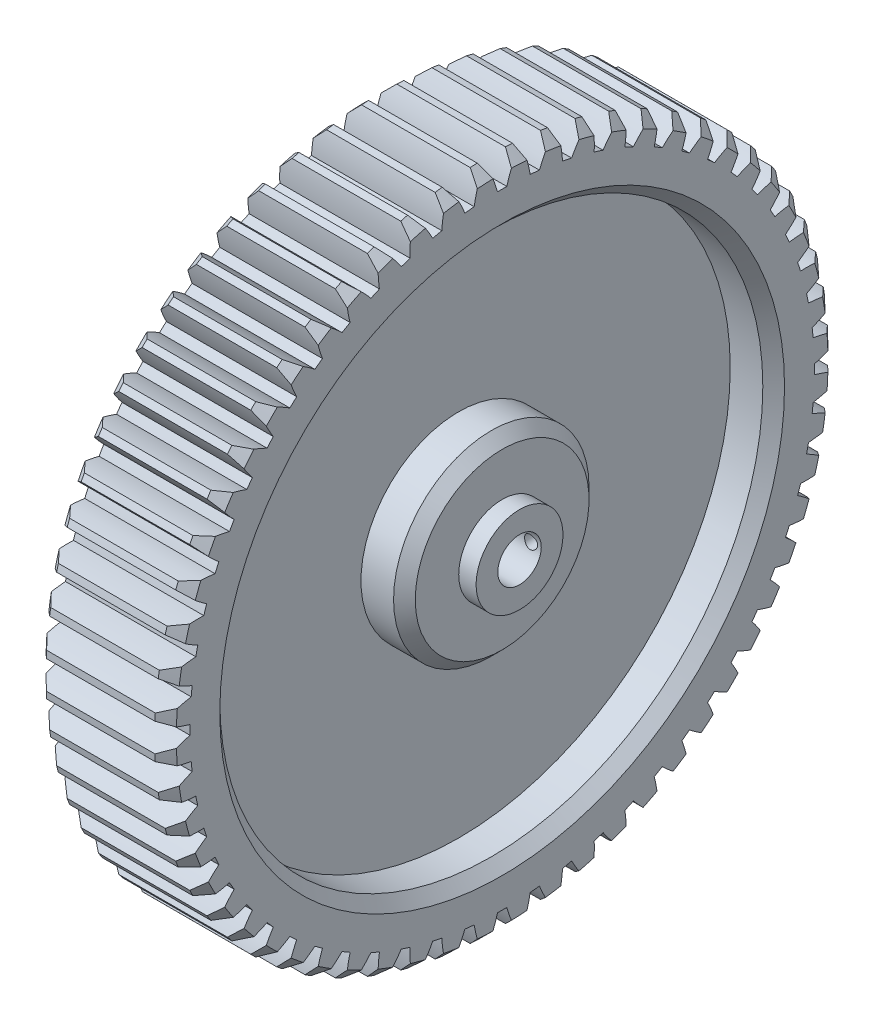
from build123d import *

# Parameters (mm, degrees)
SPUR_GEAR_GB_BORE_OUTLINE_R = 1
SPUR_GEAR_GB_BORE_DEPTH     = 6
SKETCH_2_R                  = 1.5
EXTRUDE_1_DEPTH             = 1
CUT_EXTRUDE_START           = -10
SKETCH_3_R                  = 1.5
CUT_EXTRUDE_1_DEPTH         = 10
EXTRUDE_START               = -6
SKETCH_4_R                  = 1.5
SKETCH_4_R_2                = 1
EXTRUDE_2_DEPTH             = 6
SKETCH_5_R                  = 2
SKETCH_5_R_2                = 1
EXTRUDE_3_DEPTH             = 0.8
CUT_EXTRUDE_2_DEPTH         = 2
CUT_EXTRUDE_2_DEPTH_BACK    = 0.2
SKETCH_6_R                  = 0.3
SKETCH_7_R                  = 12.5
SKETCH_7_R_2                = 4.5
CUT_EXTRUDE_3_DEPTH         = 2
CUT_EXTRUDE_START_2         = -2
SKETCH_8_R                  = 12.5
SKETCH_8_R_2                = 4.5
CUT_EXTRUDE_5_DEPTH         = 2
CHAMFER_5_SIZE              = 0.5
CHAMFER_6_SIZE              = 0.5
CHAMFER_7_SIZE              = 0.5
CHAMFER_8_SIZE              = 0.5
CHAMFER_9_SIZE              = 0.5
CHAMFER_10_SIZE             = 0.5


# Read off the part's stored shape, not the designer's step: <spur gear_gb>-<Bore>
with BuildPart() as part:
    # <spur gear_gb>-<Bore> outline → <spur gear_gb>-<Bore> (new body)
    with BuildSketch(Plane.YZ):
        with BuildLine():
            ThreePointArc((0.972356564, 15.469470667), (0.811207322, 15.478757789), (0.649970103, 15.486366225))
            ThreePointArc((0.649970103, 15.486366225), (0.404629886, 14.940245343), (0.21493681, 14.372392917))
            ThreePointArc((0.21493681, 14.372392917), (0, 14.374), (-0.21493681, 14.372392917))
            ThreePointArc((-0.21493681, 14.372392917), (-0.404629886, 14.940245343), (-0.649970103, 15.486366225))
            ThreePointArc((-0.649970103, 15.486366225), (-0.811207322, 15.478757789), (-0.972356564, 15.469470667))
            ThreePointArc((-0.972356564, 15.469470667), (-1.159267606, 14.900696456), (-1.288564781, 14.31612646))
            ThreePointArc((-1.288564781, 14.31612646), (-1.502492131, 14.295257724), (-1.716083509, 14.271192431))
            ThreePointArc((-1.716083509, 14.271192431), (-1.964094167, 14.816105776), (-2.265175562, 15.333589915))
            ThreePointArc((-2.265175562, 15.333589915), (-2.424734208, 15.309169279), (-2.58402989, 15.283088351))
            ThreePointArc((-2.58402989, 15.283088351), (-2.710463919, 14.69789242), (-2.777948587, 14.103009524))
            ThreePointArc((-2.777948587, 14.103009524), (-2.988522644, 14.059893613), (-3.198428438, 14.013633773))
            ThreePointArc((-3.198428438, 14.013633773), (-3.502039422, 14.529637853), (-3.855563284, 15.012815584))
            ThreePointArc((-3.855563284, 15.012815584), (-4.011695199, 14.971850307), (-4.167392043, 14.92926132))
            ThreePointArc((-4.167392043, 14.92926132), (-4.231963822, 14.3340552), (-4.236896607, 13.735377066))
            ThreePointArc((-4.236896607, 13.735377066), (-4.441810277, 13.670486365), (-4.645730715, 13.602538812))
            ThreePointArc((-4.645730715, 13.602538812), (-5.001615601, 14.083980178), (-5.403708647, 14.527557705))
            ThreePointArc((-5.403708647, 14.527557705), (-5.554703218, 14.470496611), (-5.705095377, 14.411866178))
            ThreePointArc((-5.705095377, 14.411866178), (-5.707097444, 13.813171071), (-5.649424302, 13.217256942))
            ThreePointArc((-5.649424302, 13.217256942), (-5.846432508, 13.131302408), (-6.042133395, 13.042411588))
            ThreePointArc((-6.042133395, 13.042411588), (-6.446393032, 13.484015468), (-6.892649847, 13.883132863))
            ThreePointArc((-6.892649847, 13.883132863), (-7.036852746, 13.810601125), (-7.180292492, 13.736571615))
            ThreePointArc((-7.180292492, 13.736571615), (-7.119702911, 13.140946949), (-7.000055721, 12.554325785))
            ThreePointArc((-7.000055721, 12.554325785), (-7.187, 12.448249154), (-7.372337196, 12.339388974))
            ThreePointArc((-7.372337196, 12.339388974), (-7.820542432, 12.736317063), (-8.306073734, 13.086601512))
            ThreePointArc((-8.306073734, 13.086601512), (-8.441905043, 12.999393803), (-8.57682082, 12.910776298))
            ThreePointArc((-8.57682082, 12.910776298), (-8.454303424, 12.324747862), (-8.273993065, 11.753846807))
            ThreePointArc((-8.273993065, 11.753846807), (-8.448825216, 11.628810277), (-8.621768129, 11.501173433))
            ThreePointArc((-8.621768129, 11.501173433), (-9.109008332, 11.849076903), (-9.628494538, 12.146690616))
            ThreePointArc((-9.628494538, 12.146690616), (-9.754466061, 12.045762403), (-9.879379704, 11.943527815))
            ThreePointArc((-9.879379704, 11.943527815), (-9.69627682, 11.373516259), (-9.457278809, 10.824590224))
            ThreePointArc((-9.457278809, 10.824590224), (-9.618083336, 10.681963721), (-9.776737166, 10.536948628))
            ThreePointArc((-9.776737166, 10.536948628), (-10.297674032, 10.832015777), (-10.845423542, 11.073698037))
            ThreePointArc((-10.845423542, 11.073698037), (-10.960155108, 10.960155108), (-11.073698037, 10.845423542))
            ThreePointArc((-11.073698037, 10.845423542), (-10.832015777, 10.297674032), (-10.536948628, 9.776737166))
            ThreePointArc((-10.536948628, 9.776737166), (-10.681963721, 9.618083336), (-10.824590224, 9.457278809))
            ThreePointArc((-10.824590224, 9.457278809), (-11.373516259, 9.69627682), (-11.943527815, 9.879379704))
            ThreePointArc((-11.943527815, 9.879379704), (-12.045762403, 9.754466061), (-12.146690616, 9.628494538))
            ThreePointArc((-12.146690616, 9.628494538), (-11.849076903, 9.109008332), (-11.501173433, 8.621768129))
            ThreePointArc((-11.501173433, 8.621768129), (-11.628810277, 8.448825216), (-11.753846807, 8.273993065))
            ThreePointArc((-11.753846807, 8.273993065), (-12.324747862, 8.454303424), (-12.910776298, 8.57682082))
            ThreePointArc((-12.910776298, 8.57682082), (-12.999393803, 8.441905043), (-13.086601512, 8.306073734))
            ThreePointArc((-13.086601512, 8.306073734), (-12.736317063, 7.820542432), (-12.339388974, 7.372337196))
            ThreePointArc((-12.339388974, 7.372337196), (-12.448249154, 7.187), (-12.554325785, 7.000055721))
            ThreePointArc((-12.554325785, 7.000055721), (-13.140946949, 7.119702911), (-13.736571615, 7.180292492))
            ThreePointArc((-13.736571615, 7.180292492), (-13.810601125, 7.036852746), (-13.883132863, 6.892649847))
            ThreePointArc((-13.883132863, 6.892649847), (-13.484015468, 6.446393032), (-13.042411588, 6.042133395))
            ThreePointArc((-13.042411588, 6.042133395), (-13.131302408, 5.846432508), (-13.217256942, 5.649424302))
            ThreePointArc((-13.217256942, 5.649424302), (-13.813171071, 5.707097444), (-14.411866178, 5.705095377))
            ThreePointArc((-14.411866178, 5.705095377), (-14.470496611, 5.554703218), (-14.527557705, 5.403708647))
            ThreePointArc((-14.527557705, 5.403708647), (-14.083980178, 5.001615601), (-13.602538812, 4.645730715))
            ThreePointArc((-13.602538812, 4.645730715), (-13.670486365, 4.441810277), (-13.735377066, 4.236896607))
            ThreePointArc((-13.735377066, 4.236896607), (-14.3340552, 4.231963822), (-14.92926132, 4.167392043))
            ThreePointArc((-14.92926132, 4.167392043), (-14.971850307, 4.011695199), (-15.012815584, 3.855563284))
            ThreePointArc((-15.012815584, 3.855563284), (-14.529637853, 3.502039422), (-14.013633773, 3.198428438))
            ThreePointArc((-14.013633773, 3.198428438), (-14.059893613, 2.988522644), (-14.103009524, 2.777948587))
            ThreePointArc((-14.103009524, 2.777948587), (-14.69789242, 2.710463919), (-15.283088351, 2.58402989))
            ThreePointArc((-15.283088351, 2.58402989), (-15.309169279, 2.424734208), (-15.333589915, 2.265175562))
            ThreePointArc((-15.333589915, 2.265175562), (-14.816105776, 1.964094167), (-14.271192431, 1.716083509))
            ThreePointArc((-14.271192431, 1.716083509), (-14.295257724, 1.502492131), (-14.31612646, 1.288564781))
            ThreePointArc((-14.31612646, 1.288564781), (-14.900696456, 1.159267606), (-15.469470667, 0.972356564))
            ThreePointArc((-15.469470667, 0.972356564), (-15.478757789, 0.811207322), (-15.486366225, 0.649970103))
            ThreePointArc((-15.486366225, 0.649970103), (-14.940245343, 0.404629886), (-14.372392917, 0.21493681))
            ThreePointArc((-14.372392917, 0.21493681), (-14.374, 0), (-14.372392917, -0.21493681))
            ThreePointArc((-14.372392917, -0.21493681), (-14.940245343, -0.404629886), (-15.486366225, -0.649970103))
            ThreePointArc((-15.486366225, -0.649970103), (-15.478757789, -0.811207322), (-15.469470667, -0.972356564))
            ThreePointArc((-15.469470667, -0.972356564), (-14.900696456, -1.159267606), (-14.31612646, -1.288564781))
            ThreePointArc((-14.31612646, -1.288564781), (-14.295257724, -1.502492131), (-14.271192431, -1.716083509))
            ThreePointArc((-14.271192431, -1.716083509), (-14.816105776, -1.964094167), (-15.333589915, -2.265175562))
            ThreePointArc((-15.333589915, -2.265175562), (-15.309169279, -2.424734208), (-15.283088351, -2.58402989))
            ThreePointArc((-15.283088351, -2.58402989), (-14.69789242, -2.710463919), (-14.103009524, -2.777948587))
            ThreePointArc((-14.103009524, -2.777948587), (-14.059893613, -2.988522644), (-14.013633773, -3.198428438))
            ThreePointArc((-14.013633773, -3.198428438), (-14.529637853, -3.502039422), (-15.012815584, -3.855563284))
            ThreePointArc((-15.012815584, -3.855563284), (-14.971850307, -4.011695199), (-14.92926132, -4.167392043))
            ThreePointArc((-14.92926132, -4.167392043), (-14.3340552, -4.231963822), (-13.735377066, -4.236896607))
            ThreePointArc((-13.735377066, -4.236896607), (-13.670486365, -4.441810277), (-13.602538812, -4.645730715))
            ThreePointArc((-13.602538812, -4.645730715), (-14.083980178, -5.001615601), (-14.527557705, -5.403708647))
            ThreePointArc((-14.527557705, -5.403708647), (-14.470496611, -5.554703218), (-14.411866178, -5.705095377))
            ThreePointArc((-14.411866178, -5.705095377), (-13.813171071, -5.707097444), (-13.217256942, -5.649424302))
            ThreePointArc((-13.217256942, -5.649424302), (-13.131302408, -5.846432508), (-13.042411588, -6.042133395))
            ThreePointArc((-13.042411588, -6.042133395), (-13.484015468, -6.446393032), (-13.883132863, -6.892649847))
            ThreePointArc((-13.883132863, -6.892649847), (-13.810601125, -7.036852746), (-13.736571615, -7.180292492))
            ThreePointArc((-13.736571615, -7.180292492), (-13.140946949, -7.119702911), (-12.554325785, -7.000055721))
            ThreePointArc((-12.554325785, -7.000055721), (-12.448249154, -7.187), (-12.339388974, -7.372337196))
            ThreePointArc((-12.339388974, -7.372337196), (-12.736317063, -7.820542432), (-13.086601512, -8.306073734))
            ThreePointArc((-13.086601512, -8.306073734), (-12.999393803, -8.441905043), (-12.910776298, -8.57682082))
            ThreePointArc((-12.910776298, -8.57682082), (-12.324747862, -8.454303424), (-11.753846807, -8.273993065))
            ThreePointArc((-11.753846807, -8.273993065), (-11.628810277, -8.448825216), (-11.501173433, -8.621768129))
            ThreePointArc((-11.501173433, -8.621768129), (-11.849076903, -9.109008332), (-12.146690616, -9.628494538))
            ThreePointArc((-12.146690616, -9.628494538), (-12.045762403, -9.754466061), (-11.943527815, -9.879379704))
            ThreePointArc((-11.943527815, -9.879379704), (-11.373516259, -9.69627682), (-10.824590224, -9.457278809))
            ThreePointArc((-10.824590224, -9.457278809), (-10.681963721, -9.618083336), (-10.536948628, -9.776737166))
            ThreePointArc((-10.536948628, -9.776737166), (-10.832015777, -10.297674032), (-11.073698037, -10.845423542))
            ThreePointArc((-11.073698037, -10.845423542), (-10.960155108, -10.960155108), (-10.845423542, -11.073698037))
            ThreePointArc((-10.845423542, -11.073698037), (-10.297674032, -10.832015777), (-9.776737166, -10.536948628))
            ThreePointArc((-9.776737166, -10.536948628), (-9.618083336, -10.681963721), (-9.457278809, -10.824590224))
            ThreePointArc((-9.457278809, -10.824590224), (-9.69627682, -11.373516259), (-9.879379704, -11.943527815))
            ThreePointArc((-9.879379704, -11.943527815), (-9.754466061, -12.045762403), (-9.628494538, -12.146690616))
            ThreePointArc((-9.628494538, -12.146690616), (-9.109008332, -11.849076903), (-8.621768129, -11.501173433))
            ThreePointArc((-8.621768129, -11.501173433), (-8.448825216, -11.628810277), (-8.273993065, -11.753846807))
            ThreePointArc((-8.273993065, -11.753846807), (-8.454303424, -12.324747862), (-8.57682082, -12.910776298))
            ThreePointArc((-8.57682082, -12.910776298), (-8.441905043, -12.999393803), (-8.306073734, -13.086601512))
            ThreePointArc((-8.306073734, -13.086601512), (-7.820542432, -12.736317063), (-7.372337196, -12.339388974))
            ThreePointArc((-7.372337196, -12.339388974), (-7.187, -12.448249154), (-7.000055721, -12.554325785))
            ThreePointArc((-7.000055721, -12.554325785), (-7.119702911, -13.140946949), (-7.180292492, -13.736571615))
            ThreePointArc((-7.180292492, -13.736571615), (-7.036852746, -13.810601125), (-6.892649847, -13.883132863))
            ThreePointArc((-6.892649847, -13.883132863), (-6.446393032, -13.484015468), (-6.042133395, -13.042411588))
            ThreePointArc((-6.042133395, -13.042411588), (-5.846432508, -13.131302408), (-5.649424302, -13.217256942))
            ThreePointArc((-5.649424302, -13.217256942), (-5.707097444, -13.813171071), (-5.705095377, -14.411866178))
            ThreePointArc((-5.705095377, -14.411866178), (-5.554703218, -14.470496611), (-5.403708647, -14.527557705))
            ThreePointArc((-5.403708647, -14.527557705), (-5.001615601, -14.083980178), (-4.645730715, -13.602538812))
            ThreePointArc((-4.645730715, -13.602538812), (-4.441810277, -13.670486365), (-4.236896607, -13.735377066))
            ThreePointArc((-4.236896607, -13.735377066), (-4.231963822, -14.3340552), (-4.167392043, -14.92926132))
            ThreePointArc((-4.167392043, -14.92926132), (-4.011695199, -14.971850307), (-3.855563284, -15.012815584))
            ThreePointArc((-3.855563284, -15.012815584), (-3.502039422, -14.529637853), (-3.198428438, -14.013633773))
            ThreePointArc((-3.198428438, -14.013633773), (-2.988522644, -14.059893613), (-2.777948587, -14.103009524))
            ThreePointArc((-2.777948587, -14.103009524), (-2.710463919, -14.69789242), (-2.58402989, -15.283088351))
            ThreePointArc((-2.58402989, -15.283088351), (-2.424734208, -15.309169279), (-2.265175562, -15.333589915))
            ThreePointArc((-2.265175562, -15.333589915), (-1.964094167, -14.816105776), (-1.716083509, -14.271192431))
            ThreePointArc((-1.716083509, -14.271192431), (-1.502492131, -14.295257724), (-1.288564781, -14.31612646))
            ThreePointArc((-1.288564781, -14.31612646), (-1.159267606, -14.900696456), (-0.972356564, -15.469470667))
            ThreePointArc((-0.972356564, -15.469470667), (-0.811207322, -15.478757789), (-0.649970103, -15.486366225))
            ThreePointArc((-0.649970103, -15.486366225), (-0.404629886, -14.940245343), (-0.21493681, -14.372392917))
            ThreePointArc((-0.21493681, -14.372392917), (0, -14.374), (0.21493681, -14.372392917))
            ThreePointArc((0.21493681, -14.372392917), (0.404629886, -14.940245343), (0.649970103, -15.486366225))
            ThreePointArc((0.649970103, -15.486366225), (0.811207322, -15.478757789), (0.972356564, -15.469470667))
            ThreePointArc((0.972356564, -15.469470667), (1.159267606, -14.900696456), (1.288564781, -14.31612646))
            ThreePointArc((1.288564781, -14.31612646), (1.502492131, -14.295257724), (1.716083509, -14.271192431))
            ThreePointArc((1.716083509, -14.271192431), (1.964094167, -14.816105776), (2.265175562, -15.333589915))
            ThreePointArc((2.265175562, -15.333589915), (2.424734208, -15.309169279), (2.58402989, -15.283088351))
            ThreePointArc((2.58402989, -15.283088351), (2.710463919, -14.69789242), (2.777948587, -14.103009524))
            ThreePointArc((2.777948587, -14.103009524), (2.988522644, -14.059893613), (3.198428438, -14.013633773))
            ThreePointArc((3.198428438, -14.013633773), (3.502039422, -14.529637853), (3.855563284, -15.012815584))
            ThreePointArc((3.855563284, -15.012815584), (4.011695199, -14.971850307), (4.167392043, -14.92926132))
            ThreePointArc((4.167392043, -14.92926132), (4.231963822, -14.3340552), (4.236896607, -13.735377066))
            ThreePointArc((4.236896607, -13.735377066), (4.441810277, -13.670486365), (4.645730715, -13.602538812))
            ThreePointArc((4.645730715, -13.602538812), (5.001615601, -14.083980178), (5.403708647, -14.527557705))
            ThreePointArc((5.403708647, -14.527557705), (5.554703218, -14.470496611), (5.705095377, -14.411866178))
            ThreePointArc((5.705095377, -14.411866178), (5.707097444, -13.813171071), (5.649424302, -13.217256942))
            ThreePointArc((5.649424302, -13.217256942), (5.846432508, -13.131302408), (6.042133395, -13.042411588))
            ThreePointArc((6.042133395, -13.042411588), (6.446393032, -13.484015468), (6.892649847, -13.883132863))
            ThreePointArc((6.892649847, -13.883132863), (7.036852746, -13.810601125), (7.180292492, -13.736571615))
            ThreePointArc((7.180292492, -13.736571615), (7.119702911, -13.140946949), (7.000055721, -12.554325785))
            ThreePointArc((7.000055721, -12.554325785), (7.187, -12.448249154), (7.372337196, -12.339388974))
            ThreePointArc((7.372337196, -12.339388974), (7.820542432, -12.736317063), (8.306073734, -13.086601512))
            ThreePointArc((8.306073734, -13.086601512), (8.441905043, -12.999393803), (8.57682082, -12.910776298))
            ThreePointArc((8.57682082, -12.910776298), (8.454303424, -12.324747862), (8.273993065, -11.753846807))
            ThreePointArc((8.273993065, -11.753846807), (8.448825216, -11.628810277), (8.621768129, -11.501173433))
            ThreePointArc((8.621768129, -11.501173433), (9.109008332, -11.849076903), (9.628494538, -12.146690616))
            ThreePointArc((9.628494538, -12.146690616), (9.754466061, -12.045762403), (9.879379704, -11.943527815))
            ThreePointArc((9.879379704, -11.943527815), (9.69627682, -11.373516259), (9.457278809, -10.824590224))
            ThreePointArc((9.457278809, -10.824590224), (9.618083336, -10.681963721), (9.776737166, -10.536948628))
            ThreePointArc((9.776737166, -10.536948628), (10.297674032, -10.832015777), (10.845423542, -11.073698037))
            ThreePointArc((10.845423542, -11.073698037), (10.960155108, -10.960155108), (11.073698037, -10.845423542))
            ThreePointArc((11.073698037, -10.845423542), (10.832015777, -10.297674032), (10.536948628, -9.776737166))
            ThreePointArc((10.536948628, -9.776737166), (10.681963721, -9.618083336), (10.824590224, -9.457278809))
            ThreePointArc((10.824590224, -9.457278809), (11.373516259, -9.69627682), (11.943527815, -9.879379704))
            ThreePointArc((11.943527815, -9.879379704), (12.045762403, -9.754466061), (12.146690616, -9.628494538))
            ThreePointArc((12.146690616, -9.628494538), (11.849076903, -9.109008332), (11.501173433, -8.621768129))
            ThreePointArc((11.501173433, -8.621768129), (11.628810277, -8.448825216), (11.753846807, -8.273993065))
            ThreePointArc((11.753846807, -8.273993065), (12.324747862, -8.454303424), (12.910776298, -8.57682082))
            ThreePointArc((12.910776298, -8.57682082), (12.999393803, -8.441905043), (13.086601512, -8.306073734))
            ThreePointArc((13.086601512, -8.306073734), (12.736317063, -7.820542432), (12.339388974, -7.372337196))
            ThreePointArc((12.339388974, -7.372337196), (12.448249154, -7.187), (12.554325785, -7.000055721))
            ThreePointArc((12.554325785, -7.000055721), (13.140946949, -7.119702911), (13.736571615, -7.180292492))
            ThreePointArc((13.736571615, -7.180292492), (13.810601125, -7.036852746), (13.883132863, -6.892649847))
            ThreePointArc((13.883132863, -6.892649847), (13.484015468, -6.446393032), (13.042411588, -6.042133395))
            ThreePointArc((13.042411588, -6.042133395), (13.131302408, -5.846432508), (13.217256942, -5.649424302))
            ThreePointArc((13.217256942, -5.649424302), (13.813171071, -5.707097444), (14.411866178, -5.705095377))
            ThreePointArc((14.411866178, -5.705095377), (14.470496611, -5.554703218), (14.527557705, -5.403708647))
            ThreePointArc((14.527557705, -5.403708647), (14.083980178, -5.001615601), (13.602538812, -4.645730715))
            ThreePointArc((13.602538812, -4.645730715), (13.670486365, -4.441810277), (13.735377066, -4.236896607))
            ThreePointArc((13.735377066, -4.236896607), (14.3340552, -4.231963822), (14.92926132, -4.167392043))
            ThreePointArc((14.92926132, -4.167392043), (14.971850307, -4.011695199), (15.012815584, -3.855563284))
            ThreePointArc((15.012815584, -3.855563284), (14.529637853, -3.502039422), (14.013633773, -3.198428438))
            ThreePointArc((14.013633773, -3.198428438), (14.059893613, -2.988522644), (14.103009524, -2.777948587))
            ThreePointArc((14.103009524, -2.777948587), (14.69789242, -2.710463919), (15.283088351, -2.58402989))
            ThreePointArc((15.283088351, -2.58402989), (15.309169279, -2.424734208), (15.333589915, -2.265175562))
            ThreePointArc((15.333589915, -2.265175562), (14.816105776, -1.964094167), (14.271192431, -1.716083509))
            ThreePointArc((14.271192431, -1.716083509), (14.295257724, -1.502492131), (14.31612646, -1.288564781))
            ThreePointArc((14.31612646, -1.288564781), (14.900696456, -1.159267606), (15.469470667, -0.972356564))
            ThreePointArc((15.469470667, -0.972356564), (15.478757789, -0.811207322), (15.486366225, -0.649970103))
            ThreePointArc((15.486366225, -0.649970103), (14.940245343, -0.404629886), (14.372392917, -0.21493681))
            ThreePointArc((14.372392917, -0.21493681), (14.374, 0), (14.372392917, 0.21493681))
            ThreePointArc((14.372392917, 0.21493681), (14.940245343, 0.404629886), (15.486366225, 0.649970103))
            ThreePointArc((15.486366225, 0.649970103), (15.478757789, 0.811207322), (15.469470667, 0.972356564))
            ThreePointArc((15.469470667, 0.972356564), (14.900696456, 1.159267606), (14.31612646, 1.288564781))
            ThreePointArc((14.31612646, 1.288564781), (14.295257724, 1.502492131), (14.271192431, 1.716083509))
            ThreePointArc((14.271192431, 1.716083509), (14.816105776, 1.964094167), (15.333589915, 2.265175562))
            ThreePointArc((15.333589915, 2.265175562), (15.309169279, 2.424734208), (15.283088351, 2.58402989))
            ThreePointArc((15.283088351, 2.58402989), (14.69789242, 2.710463919), (14.103009524, 2.777948587))
            ThreePointArc((14.103009524, 2.777948587), (14.059893613, 2.988522644), (14.013633773, 3.198428438))
            ThreePointArc((14.013633773, 3.198428438), (14.529637853, 3.502039422), (15.012815584, 3.855563284))
            ThreePointArc((15.012815584, 3.855563284), (14.971850307, 4.011695199), (14.92926132, 4.167392043))
            ThreePointArc((14.92926132, 4.167392043), (14.3340552, 4.231963822), (13.735377066, 4.236896607))
            ThreePointArc((13.735377066, 4.236896607), (13.670486365, 4.441810277), (13.602538812, 4.645730715))
            ThreePointArc((13.602538812, 4.645730715), (14.083980178, 5.001615601), (14.527557705, 5.403708647))
            ThreePointArc((14.527557705, 5.403708647), (14.470496611, 5.554703218), (14.411866178, 5.705095377))
            ThreePointArc((14.411866178, 5.705095377), (13.813171071, 5.707097444), (13.217256942, 5.649424302))
            ThreePointArc((13.217256942, 5.649424302), (13.131302408, 5.846432508), (13.042411588, 6.042133395))
            ThreePointArc((13.042411588, 6.042133395), (13.484015468, 6.446393032), (13.883132863, 6.892649847))
            ThreePointArc((13.883132863, 6.892649847), (13.810601125, 7.036852746), (13.736571615, 7.180292492))
            ThreePointArc((13.736571615, 7.180292492), (13.140946949, 7.119702911), (12.554325785, 7.000055721))
            ThreePointArc((12.554325785, 7.000055721), (12.448249154, 7.187), (12.339388974, 7.372337196))
            ThreePointArc((12.339388974, 7.372337196), (12.736317063, 7.820542432), (13.086601512, 8.306073734))
            ThreePointArc((13.086601512, 8.306073734), (12.999393803, 8.441905043), (12.910776298, 8.57682082))
            ThreePointArc((12.910776298, 8.57682082), (12.324747862, 8.454303424), (11.753846807, 8.273993065))
            ThreePointArc((11.753846807, 8.273993065), (11.628810277, 8.448825216), (11.501173433, 8.621768129))
            ThreePointArc((11.501173433, 8.621768129), (11.849076903, 9.109008332), (12.146690616, 9.628494538))
            ThreePointArc((12.146690616, 9.628494538), (12.045762403, 9.754466061), (11.943527815, 9.879379704))
            ThreePointArc((11.943527815, 9.879379704), (11.373516259, 9.69627682), (10.824590224, 9.457278809))
            ThreePointArc((10.824590224, 9.457278809), (10.681963721, 9.618083336), (10.536948628, 9.776737166))
            ThreePointArc((10.536948628, 9.776737166), (10.832015777, 10.297674032), (11.073698037, 10.845423542))
            ThreePointArc((11.073698037, 10.845423542), (10.960155108, 10.960155108), (10.845423542, 11.073698037))
            ThreePointArc((10.845423542, 11.073698037), (10.297674032, 10.832015777), (9.776737166, 10.536948628))
            ThreePointArc((9.776737166, 10.536948628), (9.618083336, 10.681963721), (9.457278809, 10.824590224))
            ThreePointArc((9.457278809, 10.824590224), (9.69627682, 11.373516259), (9.879379704, 11.943527815))
            ThreePointArc((9.879379704, 11.943527815), (9.754466061, 12.045762403), (9.628494538, 12.146690616))
            ThreePointArc((9.628494538, 12.146690616), (9.109008332, 11.849076903), (8.621768129, 11.501173433))
            ThreePointArc((8.621768129, 11.501173433), (8.448825216, 11.628810277), (8.273993065, 11.753846807))
            ThreePointArc((8.273993065, 11.753846807), (8.454303424, 12.324747862), (8.57682082, 12.910776298))
            ThreePointArc((8.57682082, 12.910776298), (8.441905043, 12.999393803), (8.306073734, 13.086601512))
            ThreePointArc((8.306073734, 13.086601512), (7.820542432, 12.736317063), (7.372337196, 12.339388974))
            ThreePointArc((7.372337196, 12.339388974), (7.187, 12.448249154), (7.000055721, 12.554325785))
            ThreePointArc((7.000055721, 12.554325785), (7.119702911, 13.140946949), (7.180292492, 13.736571615))
            ThreePointArc((7.180292492, 13.736571615), (7.036852746, 13.810601125), (6.892649847, 13.883132863))
            ThreePointArc((6.892649847, 13.883132863), (6.446393032, 13.484015468), (6.042133395, 13.042411588))
            ThreePointArc((6.042133395, 13.042411588), (5.846432508, 13.131302408), (5.649424302, 13.217256942))
            ThreePointArc((5.649424302, 13.217256942), (5.707097444, 13.813171071), (5.705095377, 14.411866178))
            ThreePointArc((5.705095377, 14.411866178), (5.554703218, 14.470496611), (5.403708647, 14.527557705))
            ThreePointArc((5.403708647, 14.527557705), (5.001615601, 14.083980178), (4.645730715, 13.602538812))
            ThreePointArc((4.645730715, 13.602538812), (4.441810277, 13.670486365), (4.236896607, 13.735377066))
            ThreePointArc((4.236896607, 13.735377066), (4.231963822, 14.3340552), (4.167392043, 14.92926132))
            ThreePointArc((4.167392043, 14.92926132), (4.011695199, 14.971850307), (3.855563284, 15.012815584))
            ThreePointArc((3.855563284, 15.012815584), (3.502039422, 14.529637853), (3.198428438, 14.013633773))
            ThreePointArc((3.198428438, 14.013633773), (2.988522644, 14.059893613), (2.777948587, 14.103009524))
            ThreePointArc((2.777948587, 14.103009524), (2.710463919, 14.69789242), (2.58402989, 15.283088351))
            ThreePointArc((2.58402989, 15.283088351), (2.424734208, 15.309169279), (2.265175562, 15.333589915))
            ThreePointArc((2.265175562, 15.333589915), (1.964094167, 14.816105776), (1.716083509, 14.271192431))
            ThreePointArc((1.716083509, 14.271192431), (1.502492131, 14.295257724), (1.288564781, 14.31612646))
            ThreePointArc((1.288564781, 14.31612646), (1.159267606, 14.900696456), (0.972356564, 15.469470667))
        make_face()
        Circle(SPUR_GEAR_GB_BORE_OUTLINE_R, mode=Mode.SUBTRACT)
    extrude(amount=SPUR_GEAR_GB_BORE_DEPTH)

    # 草图2 → 凸台-拉伸1 (add)
    with BuildSketch(Plane(origin=(6, 0, 0), x_dir=(0, 0, -1), z_dir=(1, 0, 0))):
        with Locations(Location((0, 0, 0), (0, 0, 180))):
            Circle(SKETCH_2_R)
    extrude(amount=EXTRUDE_1_DEPTH)

    # 草图3 → 切除-拉伸1 (cut)
    with BuildSketch(Plane(origin=(7, 0, 0), x_dir=(0, 0, -1), z_dir=(1, 0, 0)).offset(CUT_EXTRUDE_START)):
        Circle(SKETCH_3_R)
    extrude(amount=CUT_EXTRUDE_1_DEPTH, mode=Mode.SUBTRACT)

    # 草图4 → 凸台-拉伸2 (add)
    with BuildSketch(Plane(origin=(6, 0, 0), x_dir=(0, 0, -1), z_dir=(1, 0, 0)).offset(EXTRUDE_START)):
        Circle(SKETCH_4_R)
        Circle(SKETCH_4_R_2, mode=Mode.SUBTRACT)
    extrude(amount=EXTRUDE_2_DEPTH)

    # 草图5 → 凸台-拉伸3 (add)
    with BuildSketch(Plane(origin=(6, 0, 0), x_dir=(0, 0, -1), z_dir=(1, 0, 0))):
        with Locations(Location((0, 0, 0), (0, 0, 180))):
            Circle(SKETCH_5_R)
        Circle(SKETCH_5_R_2, mode=Mode.SUBTRACT)
    extrude(amount=EXTRUDE_3_DEPTH)

    # 草图6 → 切除-拉伸2 (cut, two sides: drawn at the far end of the back side and taken through both)
    with BuildSketch(Plane(origin=(56.1762727, -65.617825142, -4.474593868), x_dir=(-1, 0, 0), z_dir=(-2.4747772696104695e-14, -0.03776532736820143, 0.9992866355799884)).offset(-CUT_EXTRUDE_2_DEPTH_BACK)):
        with Locations(Location((49.842566165, -65.698034164, 0), (0, 0, 270))):
            Circle(SKETCH_6_R)
    extrude(amount=CUT_EXTRUDE_2_DEPTH + CUT_EXTRUDE_2_DEPTH_BACK, mode=Mode.SUBTRACT)

    # 草图7 → 切除-拉伸3 (cut)
    with BuildSketch(Plane(origin=(6, 0, 0), x_dir=(0, 0, -1), z_dir=(1, 0, 0))):
        Circle(SKETCH_7_R)
        Circle(SKETCH_7_R_2, mode=Mode.SUBTRACT)
    extrude(amount=-CUT_EXTRUDE_3_DEPTH, mode=Mode.SUBTRACT)

    # 草图8 → 切除-拉伸5 (cut)
    with BuildSketch(Plane.ZY.offset(CUT_EXTRUDE_START_2)):
        with Locations(Location((0, 0, 0), (0, 0, 180))):
            Circle(SKETCH_8_R)
        with Locations(Location((0, 0, 0), (0, 0, 180))):
            Circle(SKETCH_8_R_2, mode=Mode.SUBTRACT)
    extrude(amount=CUT_EXTRUDE_5_DEPTH, mode=Mode.SUBTRACT)

    # 倒角5
    chamfer_5_edges = [part.edges().sort_by_distance(p)[0] for p in [
        (6, 0, 12.5),
    ]]
    chamfer(chamfer_5_edges, length=CHAMFER_5_SIZE)

    # 倒角6
    chamfer_6_edges = [part.edges().sort_by_distance(p)[0] for p in [
        (6, 0, 4.5),
    ]]
    chamfer(chamfer_6_edges, length=CHAMFER_6_SIZE)

    # 倒角7
    chamfer_7_edges = [part.edges().sort_by_distance(p)[0] for p in [
        (0, 0, 4.5),
    ]]
    chamfer(chamfer_7_edges, length=CHAMFER_7_SIZE)

    # 倒角8
    chamfer_8_edges = [part.edges().sort_by_distance(p)[0] for p in [
        (0, 0, 12.5),
    ]]
    chamfer(chamfer_8_edges, length=CHAMFER_8_SIZE)

    # 倒角9
    chamfer_9_edges = [part.edges().sort_by_distance(p)[0] for p in [
        (0, 15.478757789, 0.811207322),
        (0, 15.309169279, -2.424734208),
        (0, 14.971850307, -4.011695199),
        (0, 14.470496611, -5.554703218),
        (0, 13.810601125, -7.036852746),
        (0, 12.999393803, -8.441905043),
        (0, 12.045762403, -9.754466061),
        (0, 10.960155108, -10.960155108),
        (0, 9.754466061, -12.045762403),
        (0, 8.441905043, -12.999393803),
        (0, 7.036852746, -13.810601125),
        (0, 5.554703218, -14.470496611),
        (0, 4.011695199, -14.971850307),
        (0, 2.424734208, -15.309169279),
        (0, 0.811207322, -15.478757789),
        (0, -0.811207322, -15.478757789),
        (0, -2.424734208, -15.309169279),
        (0, -4.011695199, -14.971850307),
        (0, -5.554703218, -14.470496611),
        (0, -7.036852746, -13.810601125),
        (0, -8.441905043, -12.999393803),
        (0, -9.754466061, -12.045762403),
        (0, -10.960155108, -10.960155108),
        (0, -12.045762403, -9.754466061),
        (0, -12.999393803, -8.441905043),
        (0, -13.810601125, -7.036852746),
        (0, -14.470496611, -5.554703218),
        (0, -14.971850307, -4.011695199),
        (0, -15.309169279, -2.424734208),
        (0, -15.478757789, -0.811207322),
        (0, -15.478757789, 0.811207322),
        (0, -15.309169279, 2.424734208),
        (0, -14.971850307, 4.011695199),
        (0, -14.470496611, 5.554703218),
        (0, -13.810601125, 7.036852746),
        (0, -12.999393803, 8.441905043),
        (0, -12.045762403, 9.754466061),
        (0, -10.960155108, 10.960155108),
        (0, -9.754466061, 12.045762403),
        (0, -8.441905043, 12.999393803),
        (0, -7.036852746, 13.810601125),
        (0, -5.554703218, 14.470496611),
        (0, -4.011695199, 14.971850307),
        (0, -2.424734208, 15.309169279),
        (0, -0.811207322, 15.478757789),
        (0, 0.811207322, 15.478757789),
        (0, 2.424734208, 15.309169279),
        (0, 4.011695199, 14.971850307),
        (0, 5.554703218, 14.470496611),
        (0, 7.036852746, 13.810601125),
        (0, 8.441905043, 12.999393803),
        (0, 9.754466061, 12.045762403),
        (0, 10.960155108, 10.960155108),
        (0, 12.045762403, 9.754466061),
        (0, 12.999393803, 8.441905043),
        (0, 13.810601125, 7.036852746),
        (0, 14.470496611, 5.554703218),
        (0, 14.971850307, 4.011695199),
        (0, 15.309169279, 2.424734208),
        (0, 15.478757789, -0.811207322),
    ]]
    chamfer(chamfer_9_edges, length=CHAMFER_9_SIZE)

    # 倒角10
    chamfer_10_edges = [part.edges().sort_by_distance(p)[0] for p in [
        (6, 15.478757789, -0.811207322),
        (6, 15.309169279, -2.424734208),
        (6, 14.971850307, -4.011695199),
        (6, 14.470496611, -5.554703218),
        (6, 13.810601125, -7.036852746),
        (6, 12.999393803, -8.441905043),
        (6, 12.045762403, -9.754466061),
        (6, 10.960155108, -10.960155108),
        (6, 9.754466061, -12.045762403),
        (6, 8.441905043, -12.999393803),
        (6, 7.036852746, -13.810601125),
        (6, 5.554703218, -14.470496611),
        (6, 4.011695199, -14.971850307),
        (6, 2.424734208, -15.309169279),
        (6, 0.811207322, -15.478757789),
        (6, -0.811207322, -15.478757789),
        (6, -2.424734208, -15.309169279),
        (6, -4.011695199, -14.971850307),
        (6, -5.554703218, -14.470496611),
        (6, -7.036852746, -13.810601125),
        (6, -8.441905043, -12.999393803),
        (6, -9.754466061, -12.045762403),
        (6, -10.960155108, -10.960155108),
        (6, -12.045762403, -9.754466061),
        (6, -12.999393803, -8.441905043),
        (6, -13.810601125, -7.036852746),
        (6, -14.470496611, -5.554703218),
        (6, -14.971850307, -4.011695199),
        (6, -15.309169279, -2.424734208),
        (6, -15.478757789, -0.811207322),
        (6, -15.478757789, 0.811207322),
        (6, -15.309169279, 2.424734208),
        (6, -14.971850307, 4.011695199),
        (6, -14.470496611, 5.554703218),
        (6, -13.810601125, 7.036852746),
        (6, -12.999393803, 8.441905043),
        (6, -12.045762403, 9.754466061),
        (6, -10.960155108, 10.960155108),
        (6, -9.754466061, 12.045762403),
        (6, -8.441905043, 12.999393803),
        (6, -7.036852746, 13.810601125),
        (6, -5.554703218, 14.470496611),
        (6, -4.011695199, 14.971850307),
        (6, -2.424734208, 15.309169279),
        (6, -0.811207322, 15.478757789),
        (6, 0.811207322, 15.478757789),
        (6, 2.424734208, 15.309169279),
        (6, 4.011695199, 14.971850307),
        (6, 5.554703218, 14.470496611),
        (6, 7.036852746, 13.810601125),
        (6, 8.441905043, 12.999393803),
        (6, 9.754466061, 12.045762403),
        (6, 10.960155108, 10.960155108),
        (6, 12.045762403, 9.754466061),
        (6, 12.999393803, 8.441905043),
        (6, 13.810601125, 7.036852746),
        (6, 14.470496611, 5.554703218),
        (6, 14.971850307, 4.011695199),
        (6, 15.309169279, 2.424734208),
        (6, 15.478757789, 0.811207322),
    ]]
    chamfer(chamfer_10_edges, length=CHAMFER_10_SIZE)


solid = part.part
